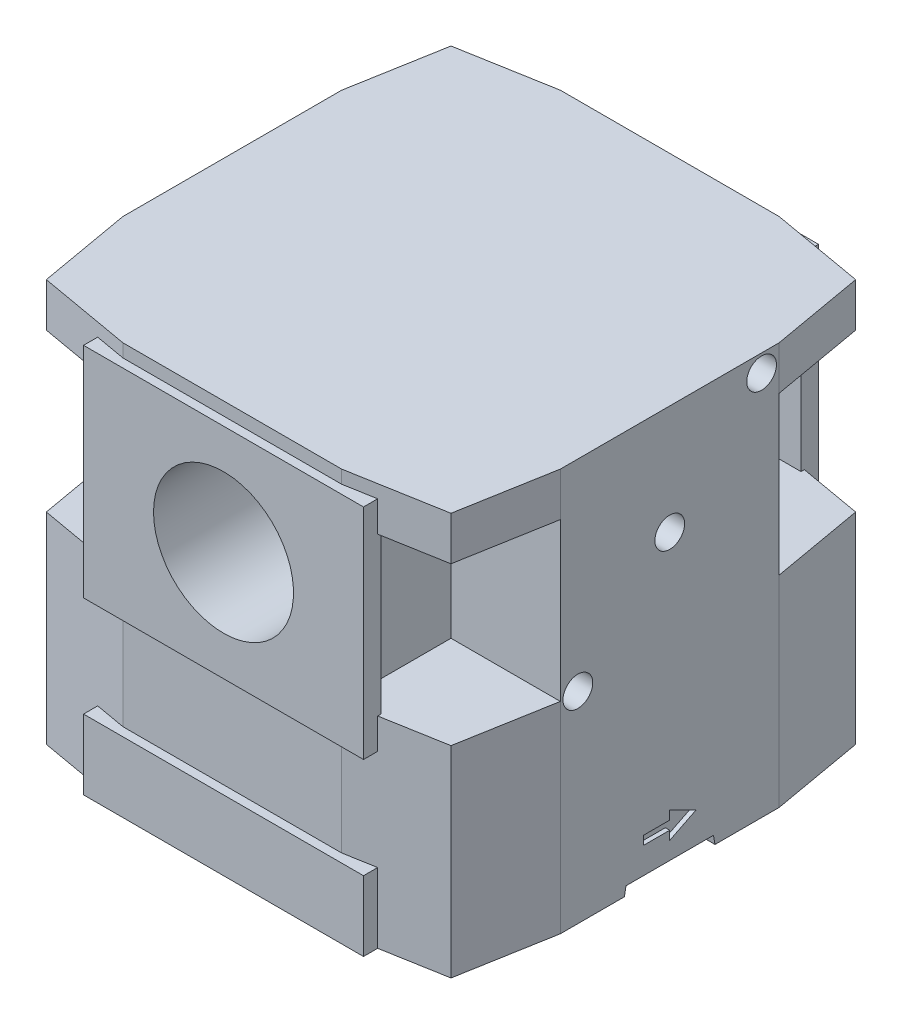
from build123d import *

# Parameters (mm, degrees)
BOSS_EXTRUDE1_DEPTH      = 5
BOSS_EXTRUDE2_DEPTH      = 18
BOSS_EXTRUDE3_DEPTH      = 23
SKETCH4_W                = 32
SKETCH4_H                = 25
SKETCH4_H_2              = 8
BOSS_EXTRUDE4_DEPTH      = 1
CUT_EXTRUDE1_DEPTH       = 73.746133918
CUT_EXTRUDE1_DEPTH_BACK  = 73.746133918
WRAP1_START              = -0.5
WRAP1_DEPTH              = 0.5
SKETCH8_R                = 7.5
SKETCH8_R_2              = 0.5
BOSS_EXTRUDE5_DEPTH      = 10
SKETCH9_R                = 8
CUT_EXTRUDE2_DEPTH       = 80.711981534
M3_CLEARANCE_HOLE1_D     = 3.4
M3_CLEARANCE_HOLE1_DEPTH = 8
M3_CLEARANCE_HOLE1_TIP   = 1.021463052
M3_CLEARANCE_HOLE2_D     = 3.4
M3_CLEARANCE_HOLE2_DEPTH = 8
M3_CLEARANCE_HOLE2_TIP   = 1.021463052
M3_CLEARANCE_HOLE3_D     = 3.4
M3_CLEARANCE_HOLE3_DEPTH = 8
M3_CLEARANCE_HOLE3_TIP   = 1.021463052
M3_CLEARANCE_HOLE4_D     = 3.4
M3_CLEARANCE_HOLE4_DEPTH = 8
M3_CLEARANCE_HOLE4_TIP   = 1.021463052
SKETCH22_R               = 22.5
SKETCH22_R_2             = 21.5
CUT_EXTRUDE3_DEPTH       = 3


# Read off the part's stored shape, not the designer's step: Wrap1
with BuildPart() as part:
    # Sketch1 → Boss-Extrude1 (new body)
    with BuildSketch(Plane(origin=(0, 0, 0), x_dir=(1, 0, 0), z_dir=(0, 1, 0))):
        Polygon((-25, 12.5), (-23.126297114, 23.126297114), (-12.5, 25), (12.5, 25), (23.126297114, 23.126297114), (25, 12.5), (25, -12.5), (23.126297114, -23.126297114), (12.5, -25), (-12.5, -25), (-23.126297114, -23.126297114), (-25, -12.5), align=None)
    extrude(amount=-BOSS_EXTRUDE1_DEPTH)

    # Sketch2 → Boss-Extrude2 (add)
    with BuildSketch(Plane.XZ.offset(5)):
        Polygon((-12.5, 25), (-12.5, 12.5), (-25, 12.5), (-25, -12.5), (-12.5, -12.5), (-12.5, -25), (12.5, -25), (12.5, -12.5), (25, -12.5), (25, 12.5), (12.5, 12.5), (12.5, 25), align=None)
    extrude(amount=BOSS_EXTRUDE2_DEPTH)

    # Sketch3 → Boss-Extrude3 (add)
    with BuildSketch(Plane.XZ.offset(23)):
        Polygon((12.5, 25), (-12.5, 25), (-12.5, 12.5), (-25, 12.5), (-25, -12.5), (-12.5, -12.5), (-12.5, -25), (12.5, -25), (12.5, -12.5), (25, -12.5), (25, 12.5), (12.5, 12.5), align=None)
        Polygon((-25, 12.5), (-23.126297114, 23.126297114), (-12.5, 25), (-12.5, 12.5), align=None)
        Polygon((12.5, 25), (23.126297114, 23.126297114), (25, 12.5), (12.5, 12.5), align=None)
        Polygon((-12.5, -25), (-23.126297114, -23.126297114), (-25, -12.5), (-12.5, -12.5), align=None)
        Polygon((25, -12.5), (23.126297114, -23.126297114), (12.5, -25), (12.5, -12.5), align=None)
    extrude(amount=BOSS_EXTRUDE3_DEPTH)

    # Sketch4 → Boss-Extrude4 (add, symmetric)
    with BuildSketch(Plane(origin=(0, 0, -25), x_dir=(-1, 0, 0), z_dir=(0, 0, -1))):
        with Locations((0, -14)):
            Rectangle(SKETCH4_W, SKETCH4_H)
        with Locations((0, -42)):
            Rectangle(SKETCH4_W, SKETCH4_H_2)
    boss_extrude4 = extrude(amount=BOSS_EXTRUDE4_DEPTH, both=True)

    # Mirror2: Boss-Extrude4 across plane
    add(boss_extrude4.mirror(Plane.XY))

    # Sketch6 → Cut-Extrude1 (cut, two sides: drawn at the far end of the back side and taken through both)
    with BuildSketch(Plane(origin=(25, 0, 0), x_dir=(0, 0, -1), z_dir=(1, 0, 0)).offset(-CUT_EXTRUDE1_DEPTH_BACK)):
        Polygon((5, -45), (-5, -45), (-5.176326981, -46), (5.176326981, -46), align=None)
    extrude(amount=CUT_EXTRUDE1_DEPTH + CUT_EXTRUDE1_DEPTH_BACK, mode=Mode.SUBTRACT)

    # Wrap1 outline → Wrap1 (cut)
    with BuildSketch(Plane(origin=(25, 0, 0), x_dir=(0, 0, -1), z_dir=(1, 0, 0)).offset(WRAP1_START)):
        Polygon((0, -41), (-3, -41), (-3, -42), (0, -42), (0, -43), (3, -41.5), (0, -40), align=None)
    wrap1 = extrude(amount=WRAP1_DEPTH, mode=Mode.SUBTRACT)

    # Mirror3: Wrap1 across plane
    add(wrap1.mirror(Plane(origin=(0, 0, 0), x_dir=(0, 0, 1), z_dir=(1, 0, 0))), mode=Mode.SUBTRACT)

    # Sketch8 → Boss-Extrude5 (add)
    with BuildSketch(Plane.XZ.offset(45)):
        with Locations(Location((0, 0, 0), (0, 0, 43.644116102))):
            Circle(SKETCH8_R)
        with Locations(Location((0, 0, 0), (0, 0, 270))):
            Circle(SKETCH8_R_2, mode=Mode.SUBTRACT)
    extrude(amount=BOSS_EXTRUDE5_DEPTH)

    # Sketch9 → Cut-Extrude2 (cut, through all)
    with BuildSketch(Plane(origin=(0, 0, -26), x_dir=(-1, 0, 0), z_dir=(0, 0, -1))):
        with Locations((0, -14)):
            Circle(SKETCH9_R)
    extrude(amount=-CUT_EXTRUDE2_DEPTH, mode=Mode.SUBTRACT)

    # M3 Clearance Hole1
    with Locations(Plane(origin=(25, 0, 0), x_dir=(0, 0, -1), z_dir=(1, 0, 0))):
        with Locations((10.5, -2), (-10.5, -23)):
            Hole(M3_CLEARANCE_HOLE1_D / 2, depth=M3_CLEARANCE_HOLE1_DEPTH)
            with Locations((0, 0, -(M3_CLEARANCE_HOLE1_DEPTH + M3_CLEARANCE_HOLE1_TIP / 2))):  # 118° drill point
                Cone(0, M3_CLEARANCE_HOLE1_D / 2, M3_CLEARANCE_HOLE1_TIP, mode=Mode.SUBTRACT)

    # M3 Clearance Hole2
    with Locations(Plane.ZY.offset(25)):
        with Locations((10.5, -2), (-10.5, -23)):
            Hole(M3_CLEARANCE_HOLE2_D / 2, depth=M3_CLEARANCE_HOLE2_DEPTH)
            with Locations((0, 0, -(M3_CLEARANCE_HOLE2_DEPTH + M3_CLEARANCE_HOLE2_TIP / 2))):  # 118° drill point
                Cone(0, M3_CLEARANCE_HOLE2_D / 2, M3_CLEARANCE_HOLE2_TIP, mode=Mode.SUBTRACT)

    # M3 Clearance Hole3
    with Locations(Plane(origin=(25, 0, 0), x_dir=(0, 0, -1), z_dir=(1, 0, 0))):
        with Locations((0, -12.5)):
            Hole(M3_CLEARANCE_HOLE3_D / 2, depth=M3_CLEARANCE_HOLE3_DEPTH)
            with Locations((0, 0, -(M3_CLEARANCE_HOLE3_DEPTH + M3_CLEARANCE_HOLE3_TIP / 2))):  # 118° drill point
                Cone(0, M3_CLEARANCE_HOLE3_D / 2, M3_CLEARANCE_HOLE3_TIP, mode=Mode.SUBTRACT)

    # M3 Clearance Hole4
    with Locations(Plane.ZY.offset(25)):
        with Locations((0, -12.5)):
            Hole(M3_CLEARANCE_HOLE4_D / 2, depth=M3_CLEARANCE_HOLE4_DEPTH)
            with Locations((0, 0, -(M3_CLEARANCE_HOLE4_DEPTH + M3_CLEARANCE_HOLE4_TIP / 2))):  # 118° drill point
                Cone(0, M3_CLEARANCE_HOLE4_D / 2, M3_CLEARANCE_HOLE4_TIP, mode=Mode.SUBTRACT)

    # Sketch22 → Cut-Extrude3 (cut)
    with BuildSketch(Plane.XZ.offset(46)):
        with Locations(Location((0, 0, 0), (0, 0, 270))):
            Circle(SKETCH22_R)
        with Locations(Location((0, 0, 0), (0, 0, 270))):
            Circle(SKETCH22_R_2, mode=Mode.SUBTRACT)
    extrude(amount=-CUT_EXTRUDE3_DEPTH, mode=Mode.SUBTRACT)


solid = part.part
